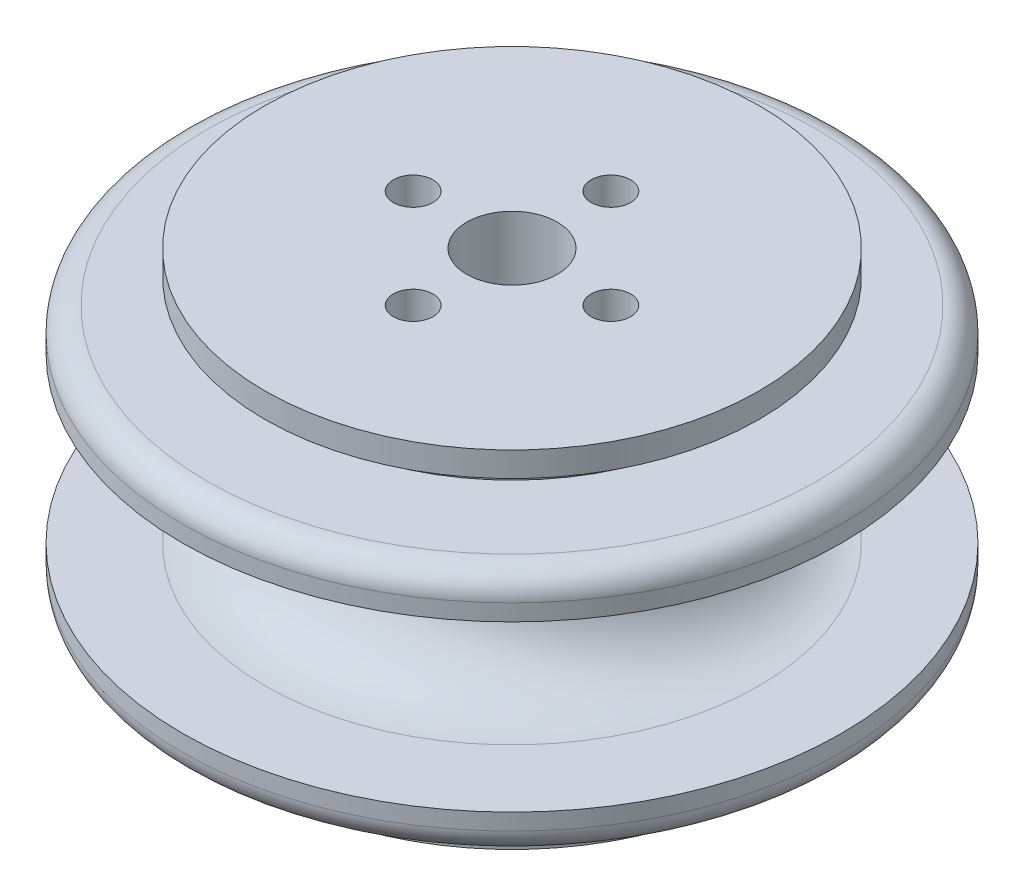
from build123d import *

# Parameters (mm, degrees)
SKETCH_1_R             = 40
EXTRUDE_1_DEPTH        = 30
SKETCH_2_R             = 26
EXTRUDE_2_DEPTH        = 3
SKETCH_3_R             = 30
EXTRUDE_3_DEPTH        = 3
FILLET_1_R             = 1
FILLET_1_OF_MIRROR_1_R = 1
SKETCH_4_W             = 20
SKETCH_4_H             = 20
FILLET_2_R             = 10
FILLET_3_R             = 3
FILLET_4_R             = 3
SKETCH_5_R             = 5.5
SKETCH_5_R_2           = 2.4
CUT_EXTRUDE_1_DEPTH    = 71.455659815


with BuildPart() as part:
    # 草图1 → 凸台-拉伸1 (new body)
    with BuildSketch(Plane(origin=(0, 0, 0), x_dir=(1, 0, 0), z_dir=(0, 1, 0))):
        with Locations(Location((0, 0, 0), (0, 0, 270))):
            Circle(SKETCH_1_R)
    extrude(amount=EXTRUDE_1_DEPTH)

    # 草图2 → 凸台-拉伸2 (add)
    with BuildSketch(Plane(origin=(0, 30, 0), x_dir=(1, 0, 0), z_dir=(0, 1, 0))):
        with Locations(Location((0, 0, 0), (0, 0, 270))):
            Circle(SKETCH_2_R)
    extrude_2 = extrude(amount=EXTRUDE_2_DEPTH)

    # 草图3 → 凸台-拉伸3 (add)
    with BuildSketch(Plane(origin=(0, 33, 0), x_dir=(1, 0, 0), z_dir=(0, 1, 0))):
        with Locations(Location((0, 0, 0), (0, 0, 270))):
            Circle(SKETCH_3_R)
    extrude_3 = extrude(amount=EXTRUDE_3_DEPTH)

    # 圆角1
    fillet_1_edges = [part.edges().sort_by_distance(p)[0] for p in [
        (0, 33, -26),
    ]]
    fillet(fillet_1_edges, radius=FILLET_1_R)

    # 镜向1: 凸台-拉伸2, 凸台-拉伸3 across plane
    add(extrude_2.mirror(Plane.ZX.offset(15)))
    add(extrude_3.mirror(Plane.ZX.offset(15)))

    # 圆角1 of 镜向1
    fillet_1_of_mirror_1_edges = [part.edges().sort_by_distance(p)[0] for p in [
        (0, -3, -26),
    ]]
    fillet(fillet_1_of_mirror_1_edges, radius=FILLET_1_OF_MIRROR_1_R)

    # 草图4 → 切除-旋转1 (revolve, cut)
    with BuildSketch(Plane.XY, mode=Mode.PRIVATE) as cut_revolve_1_sk:
        with Locations((-30, 15)):
            Rectangle(SKETCH_4_W, SKETCH_4_H)
    revolve(cut_revolve_1_sk.sketch.rotate(Axis((0, -1000, 0), (0, 1, 0)), 180), axis=Axis((0, -1000, 0), (0, 1, 0)), mode=Mode.SUBTRACT)

    # 圆角2
    fillet_2_edges = [part.edges().sort_by_distance(p)[0] for p in [
        (-20, 5, 0),
        (-20, 25, 0),
    ]]
    fillet(fillet_2_edges, radius=FILLET_2_R - 0.0001)  # a hair under: the kernel refuses the full size

    # 圆角3
    fillet_3_edges = [part.edges().sort_by_distance(p)[0] for p in [
        (0, 0, -40),
    ]]
    fillet(fillet_3_edges, radius=FILLET_3_R)

    # 圆角4
    fillet_4_edges = [part.edges().sort_by_distance(p)[0] for p in [
        (0, 30, -40),
    ]]
    fillet(fillet_4_edges, radius=FILLET_4_R)

    # 草图5 → 切除-拉伸1 (cut, through all)
    with BuildSketch(Plane(origin=(0, 36, 0), x_dir=(1, 0, 0), z_dir=(0, 1, 0))):
        with Locations(Location((0, 0, 0), (0, 0, 270))):
            Circle(SKETCH_5_R)
        with Locations(Location((0, 12, 0), (0, 0, 270))):
            Circle(SKETCH_5_R_2)
        with Locations(Location((12, 0, 0), (0, 0, 270))):
            Circle(SKETCH_5_R_2)
        with Locations(Location((0, -12, 0), (0, 0, 270))):
            Circle(SKETCH_5_R_2)
        with Locations(Location((-12, 0, 0), (0, 0, 270))):
            Circle(SKETCH_5_R_2)
    extrude(amount=-CUT_EXTRUDE_1_DEPTH, mode=Mode.SUBTRACT)


solid = part.part
